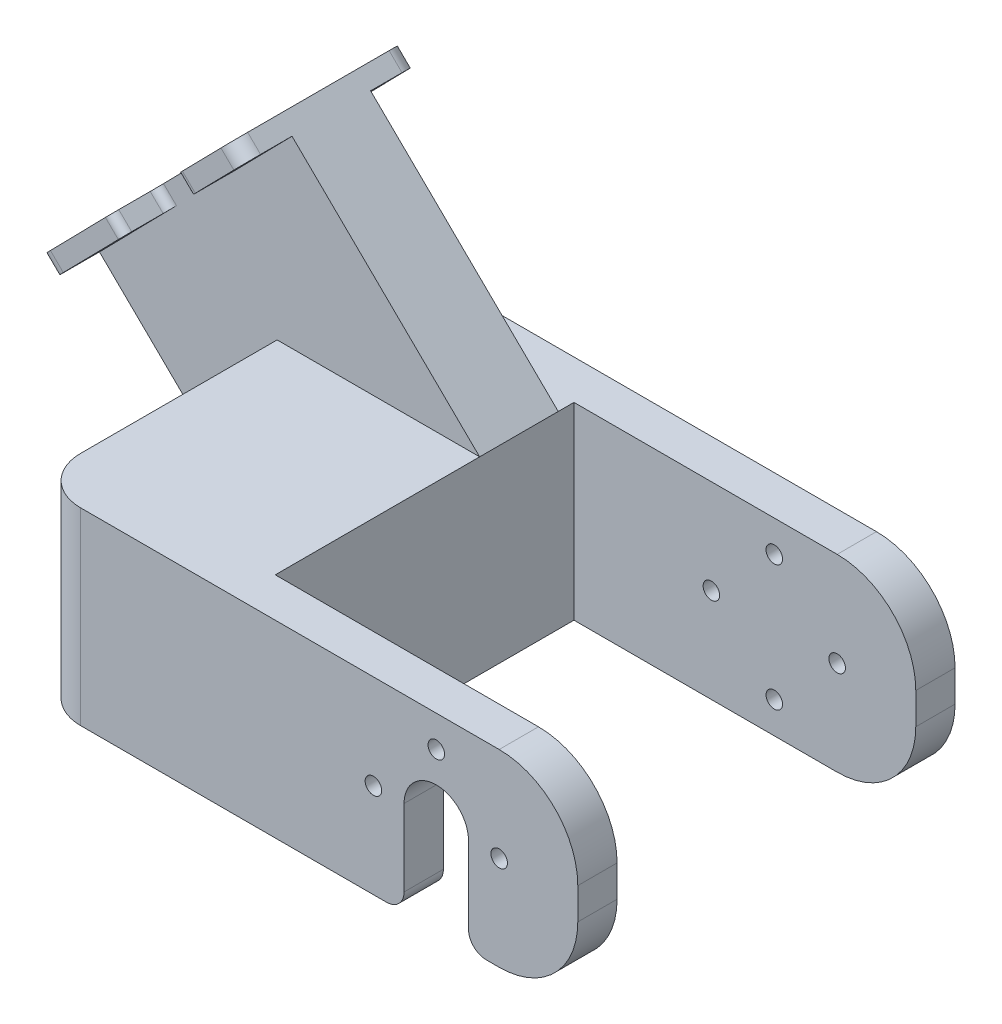
from build123d import *

# Parameters (mm, degrees)
EXTRUDE_1_DEPTH         = 24
SKETCH_2_W              = 24
SKETCH_2_H              = 29.5
CUT_EXTRUDE_1_DEPTH     = 79.714674617
SKETCH_3_R              = 1.1
CUT_EXTRUDE_2_DEPTH     = 96.205041883
SKETCH_4_W              = 15
SKETCH_4_H              = 48
EXTRUDE_2_DEPTH         = 52
SKETCH_5_W              = 35
SKETCH_5_H              = 13
CUT_EXTRUDE_3_DEPTH     = 52
SKETCH_6_W              = 35
SKETCH_6_H              = 20.5
CUT_EXTRUDE_4_DEPTH     = 11.5
SKETCH_7_W              = 35
SKETCH_7_H              = 19
CUT_EXTRUDE_5_DEPTH     = 37.5
SKETCH_8_R              = 1.1
CUT_EXTRUDE_6_DEPTH     = 3
CUT_EXTRUDE_7_DEPTH     = 96.205041883
SKETCH_10_W             = 35
SKETCH_10_H             = 22
CUT_EXTRUDE_8_DEPTH     = 11.5
SKETCH_11_W             = 12
SKETCH_11_H             = 6
CUT_EXTRUDE_9_DEPTH     = 3
FILLET_1_R              = 2
FILLET_2_R              = 1
SKETCH_14_R             = 0.75
CUT_EXTRUDE_12_DEPTH    = 8
SKETCH_17_R             = 1.9
CUT_EXTRUDE_13_DEPTH    = 1.4
SKETCH_26_W             = 65.219467354
SKETCH_26_H             = 31.879169378
CUT_EXTRUDE_17_DEPTH    = 2.75
CUT_EXTRUDE_18_DEPTH    = 0.7
SKETCH_28_R             = 4.45
EXTRUDE_11_DEPTH        = 8
EXTRUDE_12_REACH        = 89.179
SKETCH_29_W             = 35
SKETCH_29_H             = 48
SKETCH4_R               = 1.9
CUT_EXTRUDE3_DEPTH      = 1
BOSS_EXTRUDE2_DEPTH     = 9.25
CUT_EXTRUDE4_START      = -17.25
CUT_EXTRUDE4_DEPTH      = 8
BOSS_EXTRUDE3_START     = 29.5
BOSS_EXTRUDE3_DEPTH     = 9.25
CUT_EXTRUDE5_START      = 38.75
CUT_EXTRUDE5_DEPTH      = 49.724639182
SKETCH6_W               = 10
SKETCH6_H               = 20
BOSS_EXTRUDE4_DEPTH     = 9.25
BOSS_EXTRUDE5_START     = -38.75
SKETCH6_2_W             = 10
SKETCH6_2_H             = 20
BOSS_EXTRUDE5_DEPTH     = 9.25
MOVE_FACE1_BY           = 2
MOVE_FACE2_BY           = 2
MOVE_FACE3_BY           = 8
MOVE_FACE3_2_BY         = 8
CUT_EXTRUDE6_DEPTH      = 15
CUT_EXTRUDE6_DEPTH_BACK = 77.826102335
SKETCH7_W               = 37.75
SKETCH7_H               = 38
SKETCH8_R               = 1.05
CUT_EXTRUDE7_DEPTH      = 94.264409074
CUT_EXTRUDE8_DEPTH      = 91.792345492
FILLET1_R               = 10
FILLET2_R               = 2.25
FILLET3_R               = 1.75
SKETCH16_W              = 35
SKETCH16_H              = 22
BOSS_EXTRUDE6_DEPTH     = 2.3
FILLET5_R               = 2
SKETCH21_R              = 1.1
SKETCH21_W              = 6
SKETCH21_H              = 12
CUT_EXTRUDE10_DEPTH     = 2.3
FILLET6_R               = 1
SKETCH25_W              = 30.257186082
SKETCH25_H              = 41.144662004
CUT_EXTRUDE11_DEPTH     = 90.00456449
BOSS_EXTRUDE7_REACH     = 93.622
SKETCH26_W              = 10
SKETCH26_H              = 35
SKETCH27_W              = 33.484481846
SKETCH27_H              = 38
CUT_EXTRUDE12_DEPTH     = 72.028163428
FILLET7_R               = 6


with BuildPart() as part:
    # 草图1 → 凸台-拉伸1 (new, symmetric)
    with BuildSketch(Plane.XY):
        with BuildLine():
            Line((10, 10), (44, 10))
            ThreePointArc((44, 10), (54, 0), (44, -10))
            Line((44, -10), (0, -10))
            Line((0, -10), (-10, -10))
            Line((-10, -10), (-10, 0))
            Line((-10, 0), (-10, 62))
            Line((-10, 62), (10, 62))
            Line((10, 62), (10, 10))
        make_face()
    extrude(amount=EXTRUDE_1_DEPTH, both=True)

    # 草图2 → 切除-拉伸1 (cut, through all)
    with BuildSketch(Plane(origin=(0, 10, 0), x_dir=(1, 0, 0), z_dir=(0, 1, 0))):
        with Locations((42, 0)):
            Rectangle(SKETCH_2_W, SKETCH_2_H)
    extrude(amount=-CUT_EXTRUDE_1_DEPTH, mode=Mode.SUBTRACT)

    # 草图3 → 切除-拉伸2 (cut, through all)
    with BuildSketch(Plane.XY.offset(24)):
        with Locations((44, 6)):
            Circle(SKETCH_3_R)
        with Locations((50, 0)):
            Circle(SKETCH_3_R)
        with Locations((44, -6)):
            Circle(SKETCH_3_R)
        with Locations((38, 0)):
            Circle(SKETCH_3_R)
    extrude(amount=-CUT_EXTRUDE_2_DEPTH, mode=Mode.SUBTRACT)

    # 草图4 → 凸台-拉伸2 (add, through all)
    with BuildSketch(Plane(origin=(0, 10, 0), x_dir=(1, 0, 0), z_dir=(0, 1, 0))):
        with Locations((17.5, 0)):
            Rectangle(SKETCH_4_W, SKETCH_4_H)
    extrude(amount=EXTRUDE_2_DEPTH)

    # 草图5 → 切除-拉伸3 (cut)
    with BuildSketch(Plane(origin=(0, 62, 0), x_dir=(1, 0, 0), z_dir=(0, 1, 0))):
        with Locations((7.5, -17.5)):
            Rectangle(SKETCH_5_W, SKETCH_5_H)
        with Locations((7.5, 17.5)):
            Rectangle(SKETCH_5_W, SKETCH_5_H)
    extrude(amount=-CUT_EXTRUDE_3_DEPTH, mode=Mode.SUBTRACT)

    # 草图6 → 切除-拉伸4 (cut)
    with BuildSketch(Plane(origin=(0, 62, 0), x_dir=(1, 0, 0), z_dir=(0, 1, 0))):
        with Locations((7.5, 0)):
            Rectangle(SKETCH_6_W, SKETCH_6_H)
    extrude(amount=-CUT_EXTRUDE_4_DEPTH, mode=Mode.SUBTRACT)

    # 草图7 → 切除-拉伸5 (cut)
    with BuildSketch(Plane(origin=(0, 10, 0), x_dir=(1, 0, 0), z_dir=(0, 1, 0))):
        with Locations((7.5, 14.5)):
            Rectangle(SKETCH_7_W, SKETCH_7_H)
        with Locations((7.5, -14.5)):
            Rectangle(SKETCH_7_W, SKETCH_7_H)
    extrude(amount=CUT_EXTRUDE_5_DEPTH, mode=Mode.SUBTRACT)

    # 草图8 → 切除-拉伸6 (cut)
    with BuildSketch(Plane(origin=(0, 50.5, 0), x_dir=(1, 0, 0), z_dir=(0, 1, 0))):
        with Locations(Location((-7.5, 8, 0), (0, 0, 270))):
            Circle(SKETCH_8_R)
        with Locations(Location((22.5, 8, 0), (0, 0, 270))):
            Circle(SKETCH_8_R)
        with Locations(Location((22.5, -8, 0), (0, 0, 270))):
            Circle(SKETCH_8_R)
        with Locations(Location((-7.5, -8, 0), (0, 0, 270))):
            Circle(SKETCH_8_R)
    extrude(amount=-CUT_EXTRUDE_6_DEPTH, mode=Mode.SUBTRACT)

    # 草图9 → 切除-拉伸7 (cut, through all)
    with BuildSketch(Plane.XY.offset(24)):
        Polygon((-10, 4), (25, -10), (-10, -10), align=None)
    extrude(amount=-CUT_EXTRUDE_7_DEPTH, mode=Mode.SUBTRACT)

    # 草图10 → 切除-拉伸8 (cut)
    with BuildSketch(Plane(origin=(0, 62, 0), x_dir=(1, 0, 0), z_dir=(0, 1, 0))):
        with Locations((7.5, 0)):
            Rectangle(SKETCH_10_W, SKETCH_10_H)
    extrude(amount=-CUT_EXTRUDE_8_DEPTH, mode=Mode.SUBTRACT)

    # 草图11 → 切除-拉伸9 (cut)
    with BuildSketch(Plane(origin=(0, 50.5, 0), x_dir=(1, 0, 0), z_dir=(0, 1, 0))):
        with Locations((9, -8)):
            Rectangle(SKETCH_11_W, SKETCH_11_H)
        with Locations((9, 8)):
            Rectangle(SKETCH_11_W, SKETCH_11_H)
    extrude(amount=-CUT_EXTRUDE_9_DEPTH, mode=Mode.SUBTRACT)

    # 圆角1
    fillet_1_edges = [part.edges().sort_by_distance(p)[0] for p in [
        (-10, 49, -11),
        (25, 49, -11),
        (25, 49, 11),
        (-10, 49, 11),
    ]]
    fillet(fillet_1_edges, radius=FILLET_1_R)

    # 圆角2
    fillet_2_edges = [part.edges().sort_by_distance(p)[0] for p in [
        (3, 49, 11),
        (3, 49, 5),
        (15, 49, 5),
        (15, 49, 11),
        (3, 49, -11),
        (15, 49, -11),
        (15, 49, -5),
        (3, 49, -5),
    ]]
    fillet(fillet_2_edges, radius=FILLET_2_R)

    # 草图14 → 切除-拉伸12 (cut)
    with BuildSketch(Plane.XY.offset(24)):
        with Locations((12, 7)):
            Circle(SKETCH_14_R)
        with Locations((26, 7)):
            Circle(SKETCH_14_R)
    extrude(amount=-CUT_EXTRUDE_12_DEPTH, mode=Mode.SUBTRACT)

    # 草图17 → 切除-拉伸13 (cut)
    with BuildSketch(Plane.XY.offset(24)):
        with Locations((44, 6)):
            Circle(SKETCH_17_R)
        with Locations((50, 0)):
            Circle(SKETCH_17_R)
        with Locations((44, -6)):
            Circle(SKETCH_17_R)
        with Locations((38, 0)):
            Circle(SKETCH_17_R)
    extrude(amount=-CUT_EXTRUDE_13_DEPTH, mode=Mode.SUBTRACT)

    # 草图26 → 切除-拉伸17 (cut)
    with BuildSketch(Plane(origin=(30, 0, 0), x_dir=(0, 0, -1), z_dir=(1, 0, 0))):
        with Locations((0, -0.918796831)):
            Rectangle(SKETCH_26_W, SKETCH_26_H)
    extrude(amount=-CUT_EXTRUDE_17_DEPTH, mode=Mode.SUBTRACT)


with BuildPart() as cut_extrude_17_piece_1:
    # of the separate pieces the step leaves, piece 1, a body of its own (cut_extrude_17_pieces)
    add(part.part.solids().sort_by_distance((2, 47.5, -11))[0])


with BuildPart() as cut_extrude_17_piece_2:
    # of the separate pieces the step leaves, piece 2, a body of its own (cut_extrude_17_pieces)
    add(part.part.solids().sort_by_distance((44, 10, -24))[0])


with BuildPart() as cut_extrude_17_piece_3:
    # of the separate pieces the step leaves, piece 3, a body of its own (cut_extrude_17_pieces)
    add(part.part.solids().sort_by_distance((30, 10, 24))[0])


with BuildPart() as cut_extrude_17_piece_1_1:
    # Move Body 1: moved
    add(cut_extrude_17_piece_1.part.moved(Location((2.75, 0, 0))))


with BuildPart() as cut_extrude_17_piece_2_1:
    add(cut_extrude_17_piece_2.part)

    # Combine 1: union 切除-拉伸17 piece 3, 切除-拉伸17 piece 1
    add(cut_extrude_17_piece_3.part)
    add(cut_extrude_17_piece_1_1.part)

    # 草图27 → 切除-拉伸18 (cut)
    with BuildSketch(Plane.XZ.offset(-47.5)):
        with BuildLine():
            Line((25.75, 11), (18.75, 11))
            ThreePointArc((18.75, 11), (18.042893219, 10.707106781), (17.75, 10))
            Line((17.75, 10), (17.75, 6))
            ThreePointArc((17.75, 6), (17.457106781, 5.292893219), (16.75, 5))
            Line((16.75, 5), (27.75, 5))
            Line((27.75, 5), (27.75, 9))
            ThreePointArc((27.75, 9), (27.164213562, 10.414213562), (25.75, 11))
        make_face()
        with BuildLine():
            Line((5.75, 6), (5.75, 10))
            ThreePointArc((5.75, 10), (5.457106781, 10.707106781), (4.75, 11))
            Line((4.75, 11), (-5.25, 11))
            ThreePointArc((-5.25, 11), (-6.664213562, 10.414213562), (-7.25, 9))
            Line((-7.25, 9), (-7.25, 5))
            Line((-7.25, 5), (6.75, 5))
            ThreePointArc((6.75, 5), (6.042893219, 5.292893219), (5.75, 6))
        make_face()
        with BuildLine():
            Line((-5.25, -11), (4.75, -11))
            ThreePointArc((4.75, -11), (5.457106781, -10.707106781), (5.75, -10))
            Line((5.75, -10), (5.75, -6))
            ThreePointArc((5.75, -6), (6.042893219, -5.292893219), (6.75, -5))
            Line((6.75, -5), (-7.25, -5))
            Line((-7.25, -5), (-7.25, -9))
            ThreePointArc((-7.25, -9), (-6.664213562, -10.414213562), (-5.25, -11))
        make_face()
        with BuildLine():
            Line((17.75, -6), (17.75, -10))
            ThreePointArc((17.75, -10), (18.042893219, -10.707106781), (18.75, -11))
            Line((18.75, -11), (25.75, -11))
            ThreePointArc((25.75, -11), (27.164213562, -10.414213562), (27.75, -9))
            Line((27.75, -9), (27.75, -5))
            Line((27.75, -5), (16.75, -5))
            ThreePointArc((16.75, -5), (17.457106781, -5.292893219), (17.75, -6))
        make_face()
    extrude(amount=-CUT_EXTRUDE_18_DEPTH, mode=Mode.SUBTRACT)

    # 草图28 → 凸台-拉伸11 (add)
    with BuildSketch(Plane.XY.offset(24)):
        with Locations(Location((44, 0, 0), (0, 0, 167.792342))):
            Circle(SKETCH_28_R)
    extrude(amount=EXTRUDE_11_DEPTH)

    # 凸台-拉伸12: up to this face of the body (flat: up to its plane)
    extrude_12_end = Plane(cut_extrude_17_piece_2_1.part.faces().sort_by_distance((10.25, -3, 0))[0])
    # 草图29 → 凸台-拉伸12 (add, up to the picked face)
    with BuildSketch(Plane.XZ.offset(10), mode=Mode.PRIVATE) as extrude_12_sk1:
        with Locations((10.25, 0)):
            Rectangle(SKETCH_29_W, SKETCH_29_H)
    extrude_12_tool1 = split(extrude(extrude_12_sk1.sketch, amount=-EXTRUDE_12_REACH, mode=Mode.PRIVATE), bisect_by=extrude_12_end, keep=Keep.BOTH, mode=Mode.PRIVATE)
    add(extrude_12_tool1.solids().sort_by(Axis((10.25, -10, 0), (0, 1, 0)))[0])

    # Mirror12: 切除-拉伸17 piece 2 across plane


with BuildPart() as cut_extrude_17_piece_2_2:
    add(cut_extrude_17_piece_2_1.part)
    add(cut_extrude_17_piece_2_1.part.mirror(Plane.XY))

    # Sketch4 → Cut-Extrude3 (cut)
    with BuildSketch(Plane.XY.offset(24)):
        with Locations((38, 0)):
            Circle(SKETCH4_R)
        with Locations((44, -6)):
            Circle(SKETCH4_R)
        with Locations((50, 0)):
            Circle(SKETCH4_R)
        with Locations((44, 6)):
            Circle(SKETCH4_R)
    cut_extrude3 = extrude(amount=-CUT_EXTRUDE3_DEPTH, mode=Mode.SUBTRACT)

    # Mirror13: Cut-Extrude3 across plane
    add(cut_extrude3.mirror(Plane.XY), mode=Mode.SUBTRACT)

    # Sketch5 → Boss-Extrude2 (add)
    with BuildSketch(Plane(origin=(0, 0, 14.75), x_dir=(-1, 0, 0), z_dir=(0, 0, -1))):
        with BuildLine():
            Line((-44, -10), (-30, -10))
            Line((-30, -10), (-30, 10))
            Line((-30, 10), (-44, 10))
            ThreePointArc((-44, 10), (-54, 0), (-44, -10))
        make_face()
    extrude(amount=-BOSS_EXTRUDE2_DEPTH)

    # Sketch5<2> → Cut-Extrude4 (cut)
    with BuildSketch(Plane(origin=(0, 0, 14.75), x_dir=(-1, 0, 0), z_dir=(0, 0, -1)).offset(CUT_EXTRUDE4_START)):
        with BuildLine():
            Line((-44, -10), (-30, -10))
            Line((-30, -10), (-30, 10))
            Line((-30, 10), (-44, 10))
            ThreePointArc((-44, 10), (-54, 0), (-44, -10))
        make_face()
    extrude(amount=CUT_EXTRUDE4_DEPTH, mode=Mode.SUBTRACT)

    # Sketch5<3> → Boss-Extrude3 (add)
    with BuildSketch(Plane(origin=(0, 0, 14.75), x_dir=(-1, 0, 0), z_dir=(0, 0, -1)).offset(BOSS_EXTRUDE3_START)):
        with BuildLine():
            Line((-44, -10), (-30, -10))
            Line((-30, -10), (-30, 10))
            Line((-30, 10), (-44, 10))
            ThreePointArc((-44, 10), (-54, 0), (-44, -10))
        make_face()
    extrude(amount=BOSS_EXTRUDE3_DEPTH)

    # Sketch5<4> → Cut-Extrude5 (cut, through all)
    with BuildSketch(Plane(origin=(0, 0, 14.75), x_dir=(-1, 0, 0), z_dir=(0, 0, -1)).offset(CUT_EXTRUDE5_START)):
        with BuildLine():
            Line((-44, -10), (-30, -10))
            Line((-30, -10), (-30, 10))
            Line((-30, 10), (-44, 10))
            ThreePointArc((-44, 10), (-54, 0), (-44, -10))
        make_face()
    extrude(amount=CUT_EXTRUDE5_DEPTH, mode=Mode.SUBTRACT)

    # Sketch6 → Boss-Extrude4 (add)
    with BuildSketch(Plane.XY.offset(24)):
        with Locations((49, 0)):
            Rectangle(SKETCH6_W, SKETCH6_H)
    extrude(amount=-BOSS_EXTRUDE4_DEPTH)

    # Sketch6<2> → Boss-Extrude5 (add)
    with BuildSketch(Plane.XY.offset(24).offset(BOSS_EXTRUDE5_START)):
        with Locations((49, 0)):
            Rectangle(SKETCH6_2_W, SKETCH6_2_H)
    extrude(amount=-BOSS_EXTRUDE5_DEPTH)

    # Move Face1: a face moved outward by 2.0
    extrude(cut_extrude_17_piece_2_2.faces().sort_by_distance((23.375, 10, -12))[0], amount=MOVE_FACE1_BY, dir=(0, 1, 0))

    # Move Face2: a face moved outward by 2.0
    extrude(cut_extrude_17_piece_2_2.faces().sort_by_distance((17.467069892, -10, 0))[0], amount=MOVE_FACE2_BY, dir=(0, -1, 0))

    # Move Face3: a face moved outward by 8.0
    extrude(cut_extrude_17_piece_2_2.faces().sort_by_distance((54, 0, 19.375))[0], amount=MOVE_FACE3_BY, dir=(1, 0, 0))

    # Move Face3 2: a face moved outward by 8.0
    extrude(cut_extrude_17_piece_2_2.faces().sort_by_distance((54, 0, -19.375))[0], amount=MOVE_FACE3_2_BY, dir=(1, 0, 0))

    # Sketch7 → Cut-Extrude6 (cut, two sides: drawn at the far end of the back side and taken through both)
    with BuildSketch(Plane(origin=(0, 12, 0), x_dir=(1, 0, 0), z_dir=(0, 1, 0)).offset(-CUT_EXTRUDE6_DEPTH_BACK)):
        with Locations((43.125, 0)):
            Rectangle(SKETCH7_W, SKETCH7_H)
    extrude(amount=CUT_EXTRUDE6_DEPTH + CUT_EXTRUDE6_DEPTH_BACK, mode=Mode.SUBTRACT)

    # Sketch8 → Cut-Extrude7 (cut, through all)
    with BuildSketch(Plane(origin=(0, 0, -24), x_dir=(-1, 0, 0), z_dir=(0, 0, -1))):
        with Locations((-44, 8)):
            Circle(SKETCH8_R)
        with Locations((-36, 0)):
            Circle(SKETCH8_R)
        with Locations((-44, -8)):
            Circle(SKETCH8_R)
        with Locations((-52, 0)):
            Circle(SKETCH8_R)
    extrude(amount=-CUT_EXTRUDE7_DEPTH, mode=Mode.SUBTRACT)

    # Sketch9 → Cut-Extrude8 (cut, through all)
    with BuildSketch(Plane(origin=(0, 0, 19), x_dir=(-1, 0, 0), z_dir=(0, 0, -1))):
        with BuildLine():
            Line((-48.1, 0), (-48.1, -12))
            Line((-48.1, -12), (-39.9, -12))
            Line((-39.9, -12), (-39.9, 0))
            ThreePointArc((-39.9, 0), (-44, 4.1), (-48.1, 0))
        make_face()
    extrude(amount=-CUT_EXTRUDE8_DEPTH, mode=Mode.SUBTRACT)

    # Fillet1
    fillet1_edges = [cut_extrude_17_piece_2_2.edges().sort_by_distance(p)[0] for p in [
        (62, 12, -21.5),
        (62, -12, -21.5),
        (62, -12, 21.5),
        (62, 12, 21.5),
    ]]
    fillet(fillet1_edges, radius=FILLET1_R)

    # Fillet2
    fillet2_edges = [cut_extrude_17_piece_2_2.edges().sort_by_distance(p)[0] for p in [
        (39.9, -12, 21.5),
        (48.1, -12, 21.5),
    ]]
    fillet(fillet2_edges, radius=FILLET2_R)

    # Fillet3
    fillet3_edges = [cut_extrude_17_piece_2_2.edges().sort_by_distance(p)[0] for p in [
        (24.25, 27, 0),
    ]]
    fillet(fillet3_edges, radius=FILLET3_R)
    fillet3_2_edges = [cut_extrude_17_piece_2_2.edges().sort_by_distance(p)[0] for p in [
        (27.75, 27, 0),
    ]]
    fillet(fillet3_2_edges, radius=FILLET3_R - 0.0001)  # a hair under: the kernel refuses the full size

    # Sketch25 → Cut-Extrude11 (cut, through all)
    with BuildSketch(Plane.ZY.offset(7.25)):
        with Locations((0.164418045, 32.572331002)):
            Rectangle(SKETCH25_W, SKETCH25_H)
    extrude(amount=-CUT_EXTRUDE11_DEPTH, mode=Mode.SUBTRACT)



with BuildPart() as body_2:
    # Sketch16 → Boss-Extrude6 (new body)
    with BuildSketch(Plane(origin=(-22.067575609, 21.621720041, 0), x_dir=(-0.6998542122237652, -0.7142857142857143, 0), z_dir=(-0.7142857142857143, 0.6998542122237652, 0))):
        with Locations((-4.029591943, -12)):
            Rectangle(SKETCH16_W, SKETCH16_H)
    extrude(amount=-BOSS_EXTRUDE6_DEPTH)

    # Fillet5
    fillet5_edges = [body_2.edges().sort_by_distance(p)[0] for p in [
        (-6.178571429, 36.195167656, -1),
        (-30.673468856, 11.195167656, -1),
        (-30.673468856, 11.195167656, -23),
        (-6.178571429, 36.195167656, -23),
    ]]
    fillet(fillet5_edges, radius=FILLET5_R)

    # Sketch21 → Cut-Extrude10 (cut)
    with BuildSketch(Plane(origin=(-22.067575609, 21.621720041, 0), x_dir=(0, 0, 1), z_dir=(-0.7142857142857142, 0.6998542122237652, 0))):
        with Locations(Location((-20, 19.029591943, 0), (0, 0, 270))):
            Circle(SKETCH21_R)
        with Locations(Location((-4, 19.029591943, 0), (0, 0, 270))):
            Circle(SKETCH21_R)
        with Locations(Location((-4, -10.970408057, 0), (0, 0, 270))):
            Circle(SKETCH21_R)
        with Locations(Location((-20, -10.970408057, 0), (0, 0, 270))):
            Circle(SKETCH21_R)
        with Locations((-20, 5.529591943)):
            Rectangle(SKETCH21_W, SKETCH21_H)
        with Locations((-4, 5.529591943)):
            Rectangle(SKETCH21_W, SKETCH21_H)
    extrude(amount=-CUT_EXTRUDE10_DEPTH, mode=Mode.SUBTRACT)

    # Fillet6
    fillet6_edges = [body_2.edges().sort_by_distance(p)[0] for p in [
        (-13.177113551, 29.052310513, -1),
        (-21.575364097, 20.480881942, -1),
        (-21.575364097, 20.480881942, -7),
        (-13.177113551, 29.052310513, -7),
        (-21.575364097, 20.480881942, -23),
        (-13.177113551, 29.052310513, -23),
        (-13.177113551, 29.052310513, -17),
        (-21.575364097, 20.480881942, -17),
    ]]
    fillet(fillet6_edges, radius=FILLET6_R)


with BuildPart() as cut_extrude_17_piece_2_3:
    add(cut_extrude_17_piece_2_2.part)

    add(body_2.part)  # Boss-Extrude7 merges body 2
    # Boss-Extrude7: up to this plane
    boss_extrude7_end = Plane(origin=(44, -12, 24), z_dir=(0, 1, 0))
    # Sketch26 → Boss-Extrude7 (add, up to the surface)
    with BuildSketch(Plane(origin=(-20.424718466, 20.012055353, 0), x_dir=(0, 0, -1), z_dir=(0.7142857142857142, -0.6998542122237652, 0)), mode=Mode.PRIVATE) as boss_extrude7_sk1:
        with Locations((12, 4.029591943)):
            Rectangle(SKETCH26_W, SKETCH26_H)
    boss_extrude7_tool1 = split(extrude(boss_extrude7_sk1.sketch, amount=BOSS_EXTRUDE7_REACH, mode=Mode.PRIVATE), bisect_by=boss_extrude7_end, keep=Keep.BOTH, mode=Mode.PRIVATE)
    add(boss_extrude7_tool1.solids().sort_by_distance((-17.604592, 22.890335, -12))[0])

    # Sketch27 → Cut-Extrude12 (cut, through all)
    with BuildSketch(Plane(origin=(0, 12, 0), x_dir=(1, 0, 0), z_dir=(0, 1, 0))):
        with Locations((35.257759077, 0)):
            Rectangle(SKETCH27_W, SKETCH27_H)
    extrude(amount=-CUT_EXTRUDE12_DEPTH, mode=Mode.SUBTRACT)

    # Fillet7
    fillet7_edges = [cut_extrude_17_piece_2_3.edges().sort_by_distance(p)[0] for p in [
        (-7.25, 0, -24),
        (-7.25, 0, 24),
    ]]
    fillet(fillet7_edges, radius=FILLET7_R)


solid = cut_extrude_17_piece_2_3.part
